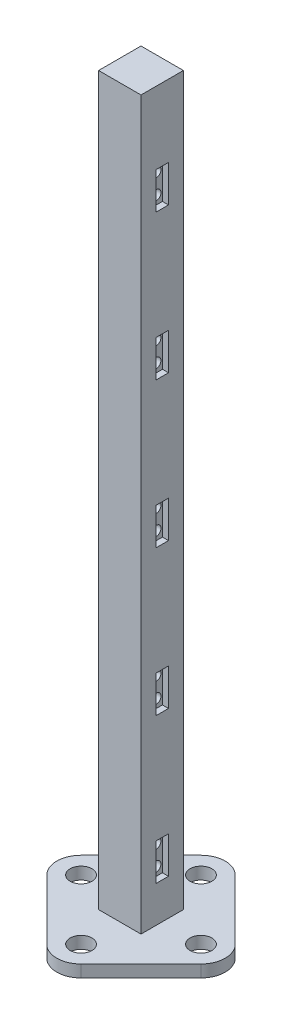
from build123d import *

# Parameters (mm, degrees)
SKETCH1_R             = 4.5
BOSS_EXTRUDE1_DEPTH   = 2.5
SKETCH2_W             = 17.5
SKETCH2_H             = 17.5
BOSS_EXTRUDE2_DEPTH   = 300
SKETCH3_W             = 5.2
SKETCH3_H             = 15.2
CUT_EXTRUDE1_DEPTH    = 2.5
F_4_0MM_DOWEL_HOLE1_D = 4
LPATTERN1_COUNT       = 5
LPATTERN1_PITCH       = 60


with BuildPart() as part:
    # Sketch1 → Boss-Extrude1 (new, symmetric)
    with BuildSketch(Plane(origin=(0, 0, 0), x_dir=(1, 0, 0), z_dir=(0, 1, 0))):
        with BuildLine():
            Line((-31.821067812, 7.071067812), (-7.071067812, 31.821067812))
            ThreePointArc((-7.071067812, 31.821067812), (0, 34.75), (7.071067812, 31.821067812))
            Line((7.071067812, 31.821067812), (31.821067812, 7.071067812))
            ThreePointArc((31.821067812, 7.071067812), (34.75, 0), (31.821067812, -7.071067812))
            Line((31.821067812, -7.071067812), (7.071067812, -31.821067812))
            ThreePointArc((7.071067812, -31.821067812), (0, -34.75), (-7.071067812, -31.821067812))
            Line((-7.071067812, -31.821067812), (-31.821067812, -7.071067812))
            ThreePointArc((-31.821067812, -7.071067812), (-34.75, 0), (-31.821067812, 7.071067812))
        make_face()
        with Locations((0, 24.75)):
            Circle(SKETCH1_R, mode=Mode.SUBTRACT)
        with Locations((24.75, 0)):
            Circle(SKETCH1_R, mode=Mode.SUBTRACT)
        with Locations((0, -24.75)):
            Circle(SKETCH1_R, mode=Mode.SUBTRACT)
        with Locations((-24.75, 0)):
            Circle(SKETCH1_R, mode=Mode.SUBTRACT)
    extrude(amount=BOSS_EXTRUDE1_DEPTH, both=True)

    # Sketch2 → Boss-Extrude2 (add)
    with BuildSketch(Plane(origin=(0, 2.5, 0), x_dir=(1, 0, 0), z_dir=(0, 1, 0))):
        Rectangle(SKETCH2_W, SKETCH2_H)
    extrude(amount=BOSS_EXTRUDE2_DEPTH)

    # Sketch3 → Cut-Extrude1 (cut)
    with BuildSketch(Plane(origin=(8.75, 0, 0), x_dir=(0, 0, -1), z_dir=(1, 0, 0))):
        with Locations((0, 25.1)):
            Rectangle(SKETCH3_W, SKETCH3_H)
    cut_extrude1 = extrude(amount=-CUT_EXTRUDE1_DEPTH, mode=Mode.SUBTRACT)

    # Ø4.0mm Dowel Hole1 (through all)
    with Locations(Plane(origin=(6.25, 0, 0), x_dir=(0, 0, -1), z_dir=(1, 0, 0))):
        with Locations((0, 21), (0, 29.2)):
            f_4_0mm_dowel_hole1 = Hole(F_4_0MM_DOWEL_HOLE1_D / 2)

    # LPattern1: Cut-Extrude1, Ø4.0mm Dowel Hole1 ×5
    with Locations(*[(0, i * LPATTERN1_PITCH, 0) for i in range(1, LPATTERN1_COUNT)]):
        add(cut_extrude1, mode=Mode.SUBTRACT)
        add(f_4_0mm_dowel_hole1, mode=Mode.SUBTRACT)


solid = part.part
